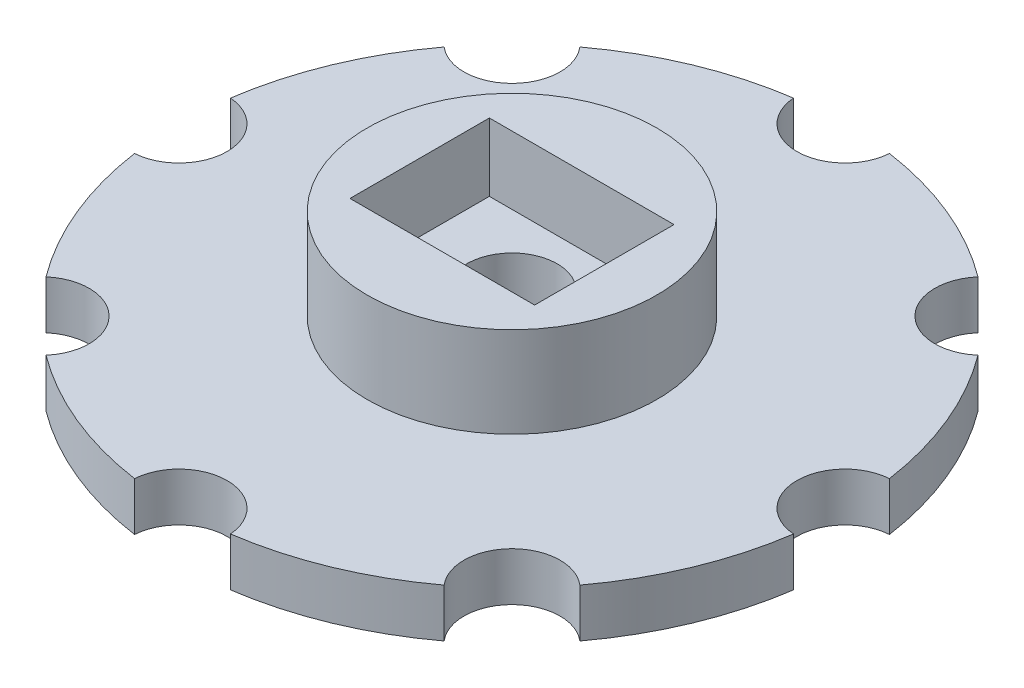
from build123d import *

# Parameters (mm, degrees)
EXTRUDE1_DEPTH      = 2.89052
EXTRUDE1_DEPTH_BACK = 0.508
SKETCH5_R           = 10.16
EXTRUDE2_DEPTH      = 6.35
CUT_EXTRUDE1_START  = -0.508
SKETCH3_R           = 3.175
CUT_EXTRUDE1_DEPTH  = 9.74852
SPLIT1_START        = -6.477
SPLIT1_OUTLINE_W    = 4.7625
SPLIT1_OUTLINE_H    = 9.779
SPLIT1_DEPTH        = 12.954


# Read off the part's stored shape, not the designer's step: Split1
with BuildPart() as part:
    # Sketch1 → Extrude1 (new, two sides: drawn at the far end of the back side and taken through both)
    with BuildSketch(Plane(origin=(0, 0, 0), x_dir=(1, 0, 0), z_dir=(0, 1, 0)).offset(-EXTRUDE1_DEPTH_BACK)):
        with BuildLine():
            ThreePointArc((-3.364632139, 23.11648266), (-8.939508898, 21.581883622), (-13.966667445, 18.724975848))
            ThreePointArc((-13.966667445, 18.724975848), (-14.132678071, 14.132678071), (-18.724975848, 13.966667445))
            ThreePointArc((-18.724975848, 13.966667445), (-21.581883622, 8.939508898), (-23.11648266, 3.364632139))
            ThreePointArc((-23.11648266, 3.364632139), (-19.986625, 0), (-23.11648266, -3.364632139))
            ThreePointArc((-23.11648266, -3.364632139), (-21.581883622, -8.939508898), (-18.724975848, -13.966667445))
            ThreePointArc((-18.724975848, -13.966667445), (-14.132678071, -14.132678071), (-13.966667445, -18.724975848))
            ThreePointArc((-13.966667445, -18.724975848), (-8.939508898, -21.581883622), (-3.364632139, -23.11648266))
            ThreePointArc((-3.364632139, -23.11648266), (0, -19.986625), (3.364632139, -23.11648266))
            ThreePointArc((3.364632139, -23.11648266), (8.939508898, -21.581883622), (13.966667445, -18.724975848))
            ThreePointArc((13.966667445, -18.724975848), (14.132678071, -14.132678071), (18.724975848, -13.966667445))
            ThreePointArc((18.724975848, -13.966667445), (21.581883622, -8.939508898), (23.11648266, -3.364632139))
            ThreePointArc((23.11648266, -3.364632139), (19.986625, 0), (23.11648266, 3.364632139))
            ThreePointArc((23.11648266, 3.364632139), (21.581883622, 8.939508898), (18.724975848, 13.966667445))
            ThreePointArc((18.724975848, 13.966667445), (14.132678071, 14.132678071), (13.966667445, 18.724975848))
            ThreePointArc((13.966667445, 18.724975848), (8.939508898, 21.581883622), (3.364632139, 23.11648266))
            ThreePointArc((3.364632139, 23.11648266), (0, 19.986625), (-3.364632139, 23.11648266))
        make_face()
    extrude(amount=EXTRUDE1_DEPTH + EXTRUDE1_DEPTH_BACK)

    # Sketch5 → Extrude2 (add)
    with BuildSketch(Plane(origin=(0, 2.89052, 0), x_dir=(-1, 0, 0), z_dir=(0, 1, 0))):
        with Locations(Location((0, 0, 0), (0, 0, 90))):
            Circle(SKETCH5_R)
    extrude(amount=EXTRUDE2_DEPTH)

    # Sketch3 → Cut-Extrude1 (cut)
    with BuildSketch(Plane(origin=(0, 0, 0), x_dir=(1, 0, 0), z_dir=(0, 1, 0)).offset(CUT_EXTRUDE1_START)):
        with Locations(Location((0, 0, 0), (0, 0, 270))):
            Circle(SKETCH3_R)
    extrude(amount=CUT_EXTRUDE1_DEPTH, mode=Mode.SUBTRACT)

    # Split1 outline → Split1 (cut)
    with BuildSketch(Plane.YZ.offset(SPLIT1_START)):
        with Locations((6.85927, 0)):
            Rectangle(SPLIT1_OUTLINE_W, SPLIT1_OUTLINE_H)
    extrude(amount=SPLIT1_DEPTH, mode=Mode.SUBTRACT)


solid = part.part
